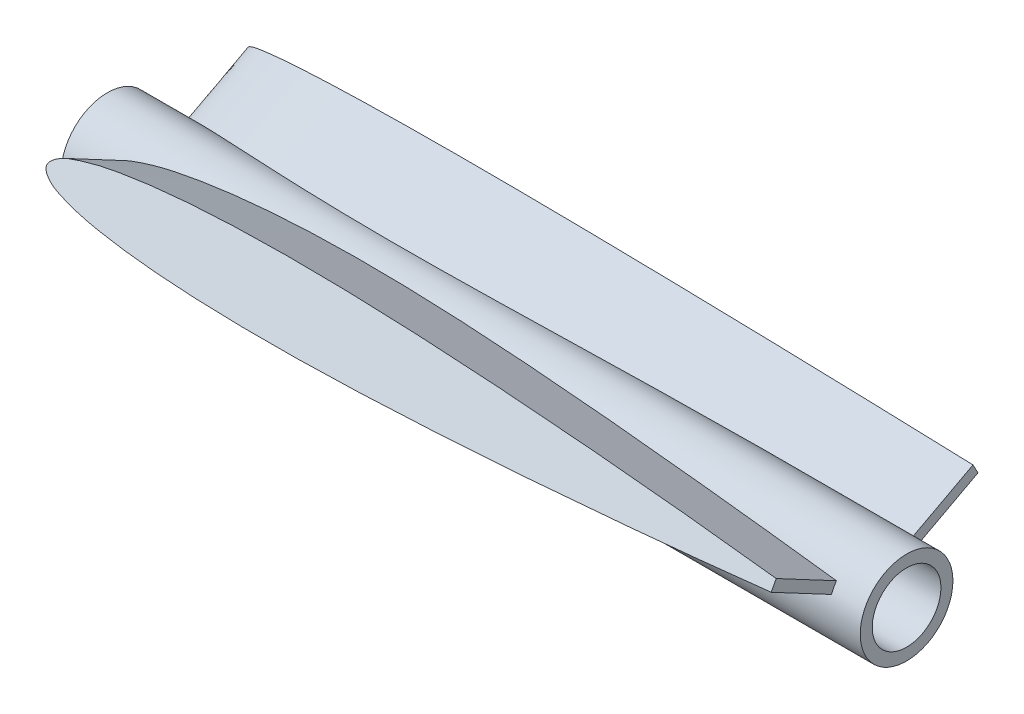
from build123d import *

# Parameters (mm, degrees)
EXTRUDE_1_DEPTH      = 190
EXTRUDE_1_DEPTH_BACK = 10
SKETCH_6_R           = 11.6
SKETCH_6_R_2         = 8.6
EXTRUDE_2_REACH      = 197.152


with BuildPart() as part:
    # Эскиз6 → Бобышка-Вытянуть1 (new, two sides: drawn at the far end of the back side and taken through both)
    with BuildSketch(Plane(origin=(0, 0, 0), x_dir=(0, 0, -1), z_dir=(1, 0, 0)).offset(-EXTRUDE_1_DEPTH_BACK)):
        with Locations((-25.252301156, -13.426886696)):
            Circle(SKETCH_6_R)
        with Locations((-25.252301156, -13.426886696)):
            Circle(SKETCH_6_R_2, mode=Mode.SUBTRACT)
    extrude(amount=EXTRUDE_1_DEPTH + EXTRUDE_1_DEPTH_BACK)

    # Эскиз5 → Бобышка-Вытянуть2 (add, up to next)
    with BuildSketch(Plane(origin=(0, 0, 0), x_dir=(-1, 0, 0), z_dir=(0, -0.46947156278589147, 0.8829475928589267)), mode=Mode.PRIVATE) as extrude_2_sk1:
        with BuildLine():
            Line((-182, -1.331404921), (-182, 1.331404921))
            add(Edge.make_bspline(
                [(0, 0), (0, 0.935502638), (-2.27255633, 2.575925139), (-5.556771363, 3.642454712), (-9.737509568, 4.687162463), (-14.603656057, 5.487341662), (-21.113008927, 6.313420575), (-29.237058106, 7.005349565), (-38.995662394, 7.497703972), (-48.748351471, 7.755020887), (-61.750574897, 7.849257289), (-78.005067187, 7.610745658), (-97.505866771, 6.926671458), (-117.00605402, 5.970408057), (-136.50584792, 4.792830297), (-156.006422045, 3.439041438), (-171.170177646, 2.251181479), (-179.833667096, 1.518726568), (-182, 1.331404921)],
                knots=[0.5, 0.5, 0.5, 0.5, 0.508804888, 0.515439546, 0.528209398, 0.540779549, 0.553268654, 0.578140525, 0.602949076, 0.62773306, 0.652508673, 0.70206263, 0.751640903, 0.801249026, 0.850887776, 0.900556598, 0.950258285, 0.966833902, 0.966833902, 0.966833902, 0.966833902], degree=3))
            add(Edge.make_bspline(
                [(-182, -1.331404921), (-179.833667096, -1.518726568), (-171.170177646, -2.251181479), (-156.006422045, -3.439041438), (-136.50584792, -4.792830297), (-117.00605402, -5.970408057), (-97.505866771, -6.926671458), (-78.005067187, -7.610745658), (-61.750574897, -7.849257289), (-48.748351471, -7.755020887), (-38.995662394, -7.497703972), (-29.237058106, -7.005349565), (-21.113008927, -6.313420575), (-14.603656057, -5.487341662), (-9.737509568, -4.687162463), (-5.556771363, -3.642454712), (-2.27255633, -2.575925139), (0, -0.935502638), (0, 0)],
                knots=[0.033166098, 0.033166098, 0.033166098, 0.033166098, 0.049741715, 0.099443402, 0.149112224, 0.198750974, 0.248359097, 0.29793737, 0.347491327, 0.37226694, 0.397050924, 0.421859475, 0.446731346, 0.459220451, 0.471790602, 0.484560454, 0.491195112, 0.5, 0.5, 0.5, 0.5], degree=3))
        make_face()
    extrude_2_tool1 = extrude(extrude_2_sk1.sketch, amount=EXTRUDE_2_REACH, mode=Mode.PRIVATE) - part.part
    extrude_2 = extrude_2_tool1.solids().sort_by_distance((80.99793, 0, 0))[0]
    add(extrude_2)

    # Зеркальное отражение1: Бобышка-Вытянуть2 across plane
    add(extrude_2.mirror(Plane.XY.offset(25.252301156)))


solid = part.part
